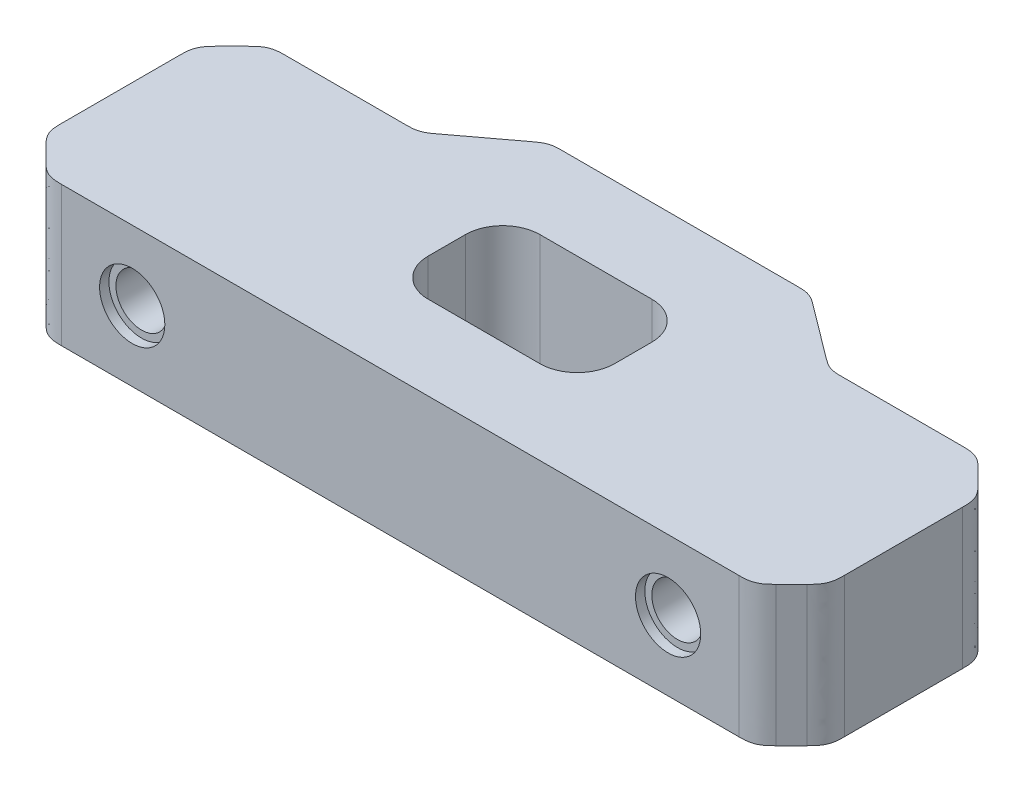
from build123d import *

# Parameters (mm, degrees)
ESQUISSE1_W                  = 20
ESQUISSE1_H                  = 12
BOSS_EXTRU_1_DEPTH           = 15
ESQUISSE1_4_R                = 4
ENL_V_MAT_EXTRU_1_DEPTH      = 12
CONG_2_R                     = 4
ENL_V_MAT_EXTRU_2_DEPTH      = 54.749418763
ENL_V_MAT_EXTRU_2_DEPTH_BACK = 10
ESQUISSE2_R                  = 2.75
ESQUISSE4_R                  = 3.5
ENL_V_MAT_EXTRU_3_DEPTH      = 1
ESQUISSE5_R                  = 3.5
ENL_V_MAT_EXTRU_4_DEPTH      = 1


with BuildPart() as part:
    # Esquisse1 → Boss.-Extru.1 (new body)
    with BuildSketch(Plane(origin=(0, 0, 0), x_dir=(1, 0, 0), z_dir=(0, 1, 0))):
        Polygon((-38, 12), (-42, 8), (-42, -8), (-38, -12), (38, -12), (42, -8), (42, 8), (38, 12), (22, 12), (14, 18), (-14, 18), (-22, 12), align=None)
        with Locations((0, 3)):
            Rectangle(ESQUISSE1_W, ESQUISSE1_H, mode=Mode.SUBTRACT)
    extrude(amount=BOSS_EXTRU_1_DEPTH)

    # Congé1
    # a fillet whose section is not a circle: 4 mm, written as the material it adds along each edge
    with BuildSketch(Plane(origin=(22, 0, -12), x_dir=(1, 0, 0), z_dir=(0, 1, 0)), Plane(origin=(-22, 0, -12), x_dir=(0.7999999999999996, 0, -0.6000000000000003), z_dir=(0, 1, 0))) as cong_1_piece_1:
        with BuildLine():
            add(Edge.make_bspline([(1.333333333, 0), (1.087283439, 0), (0.841233545, 0), (0.292751215, 0.037020099), (-0.211988912, 0.205266808), (-0.672986836, 0.504740127), (-0.869826751, 0.652370064), (-1.066666667, 0.8)], knots=[0, 0, 0, 0, 0, 0, 0.5, 0.5, 1, 1, 1, 1, 1, 1], degree=5))
            Line((-1.066666667, 0.8), (0, 0))
            Line((0, 0), (1.333333333, 0))
        make_face()
    extrude(amount=15)
    # a fillet whose section is not a circle: 4 mm, written as the material it takes off along each edge
    with BuildSketch(Plane(origin=(42, -4.142135624, 8), x_dir=(-0.707106781186547, 0, 0.7071067811865481), z_dir=(0, 1, 0)), Plane(origin=(38, -4.142135624, 12), x_dir=(-1, 0, 0), z_dir=(0, 1, 0)), Plane(origin=(42, -4.142135624, -8), x_dir=(0, 0, 1), z_dir=(0, 1, 0)), Plane(origin=(38, -4.142135624, -12), x_dir=(0.7071067811865481, 0, 0.707106781186547), z_dir=(0, 1, 0)), Plane(origin=(-42, -4.142135624, -8), x_dir=(0.7071067811865475, 0, -0.7071067811865475), z_dir=(0, 1, 0)), Plane(origin=(-42, -4.142135624, 8), x_dir=(0, 0, -1), z_dir=(0, 1, 0)), Plane(origin=(-38, -4.142135624, 12), x_dir=(-0.7071067811865465, 0, -0.7071067811865486), z_dir=(0, 1, 0))) as cong_1_2_piece_1:
        with BuildLine():
            add(Edge.make_bspline([(1.656854249, 0), (1.35356905, 0), (1.050283851, 0), (0.373674798, -0.056927592), (-0.223974097, -0.30448187), (-0.742662833, -0.742662833), (-0.957117854, -0.957117854), (-1.171572875, -1.171572875)], knots=[0, 0, 0, 0, 0, 0, 0.5, 0.5, 1, 1, 1, 1, 1, 1], degree=5))
            Line((-1.171572875, -1.171572875), (0, 0))
            Line((0, 0), (1.656854249, 0))
        make_face()
    extrude(amount=23.284271247, mode=Mode.SUBTRACT)
    with BuildSketch(Plane(origin=(14, -3.333333333, -18), x_dir=(0.7999999999999996, 0, 0.6000000000000003), z_dir=(0, 1, 0)), Plane(origin=(-14, -3.333333333, -18), x_dir=(1, 0, 0), z_dir=(0, 1, 0))) as cong_1_2_piece_2:
        with BuildLine():
            add(Edge.make_bspline([(1.333333333, 0), (1.087283439, 0), (0.841233545, 0), (0.292751215, -0.037020099), (-0.211988912, -0.205266808), (-0.672986836, -0.504740127), (-0.869826751, -0.652370064), (-1.066666667, -0.8)], knots=[0, 0, 0, 0, 0, 0, 0.5, 0.5, 1, 1, 1, 1, 1, 1], degree=5))
            Line((-1.066666667, -0.8), (0, 0))
            Line((0, 0), (1.333333333, 0))
        make_face()
    extrude(amount=21.666666667, mode=Mode.SUBTRACT)
    with BuildSketch(Plane(origin=(-38, -4.142135624, -12), x_dir=(-0.7071067811865465, 0, 0.7071067811865486), z_dir=(0, 1, 0))) as cong_1_2_piece_3:
        with BuildLine():
            add(Edge.make_bspline([(1.656854249, 0), (1.35356905, 0), (1.050283851, 0), (0.373674798, 0.056927592), (-0.223974097, 0.30448187), (-0.742662833, 0.742662833), (-0.957117854, 0.957117854), (-1.171572875, 1.171572875)], knots=[0, 0, 0, 0, 0, 0, 0.5, 0.5, 1, 1, 1, 1, 1, 1], degree=5))
            Line((-1.171572875, 1.171572875), (0, 0))
            Line((0, 0), (1.656854249, 0))
        make_face()
    extrude(amount=23.284271247, mode=Mode.SUBTRACT)

    # Esquisse1<4> → Enlèv. mat.-Extru.1 (cut)
    with BuildSketch(Plane(origin=(0, 0, 0), x_dir=(1, 0, 0), z_dir=(0, 1, 0))):
        with Locations(Location((-30, 0, 0), (0, 0, 270))):
            Circle(ESQUISSE1_4_R)
        with Locations(Location((30, 0, 0), (0, 0, 270))):
            Circle(ESQUISSE1_4_R)
    extrude(amount=ENL_V_MAT_EXTRU_1_DEPTH, mode=Mode.SUBTRACT)

    # Congé2
    cong_2_edges = [part.edges().sort_by_distance(p)[0] for p in [
        (-10, 7.5, -9),
        (-10, 7.5, 3),
        (10, 7.5, 3),
        (10, 7.5, -9),
    ]]
    fillet(cong_2_edges, radius=CONG_2_R)

    # Esquisse2 → Enlèv. mat.-Extru.2 (cut, two sides: drawn at the far end of the back side and taken through both)
    with BuildSketch(Plane.XY.offset(12).offset(-ENL_V_MAT_EXTRU_2_DEPTH_BACK)):
        with Locations(Location((-28.75, 7.5, 0), (0, 0, 180))):
            Circle(ESQUISSE2_R)
        with Locations(Location((28.75, 7.5, 0), (0, 0, 180))):
            Circle(ESQUISSE2_R)
    extrude(amount=ENL_V_MAT_EXTRU_2_DEPTH + ENL_V_MAT_EXTRU_2_DEPTH_BACK, mode=Mode.SUBTRACT)

    # Esquisse4 → Enlèv. mat.-Extru.3 (cut)
    with BuildSketch(Plane.XY.offset(12)):
        with Locations((28.75, 7.5)):
            Circle(ESQUISSE4_R)
    extrude(amount=-ENL_V_MAT_EXTRU_3_DEPTH, mode=Mode.SUBTRACT)

    # Esquisse5 → Enlèv. mat.-Extru.4 (cut)
    with BuildSketch(Plane.XY.offset(12)):
        with Locations((-28.75, 7.5)):
            Circle(ESQUISSE5_R)
    extrude(amount=-ENL_V_MAT_EXTRU_4_DEPTH, mode=Mode.SUBTRACT)


solid = part.part
